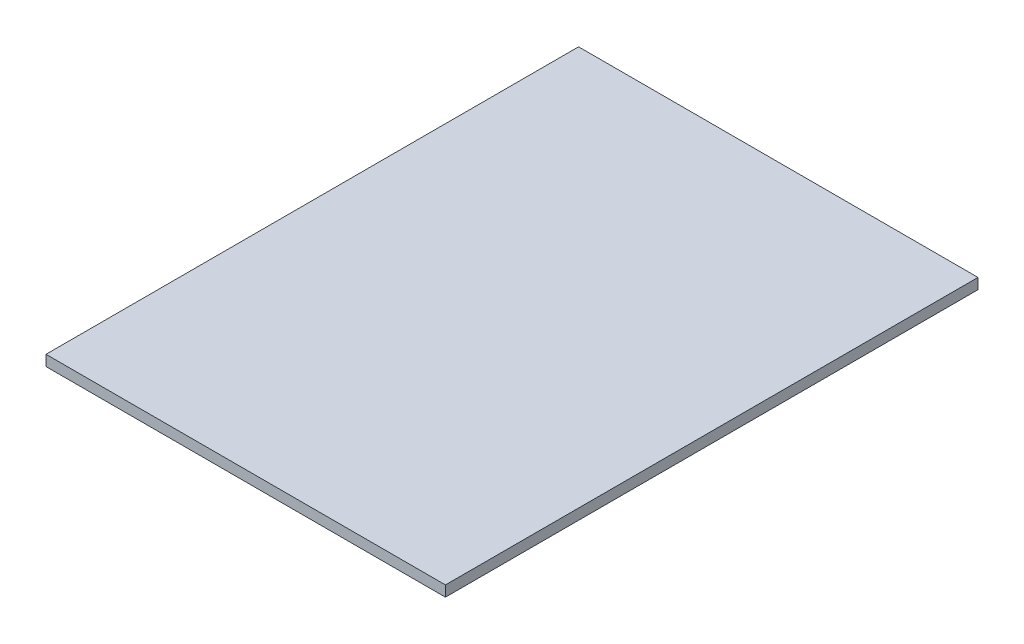
from build123d import *

# Parameters (mm, degrees)
SKETCH1_W           = 75
SKETCH1_H           = 100
BOSS_EXTRUDE1_DEPTH = 2


with BuildPart() as part:
    # Sketch1 → Boss-Extrude1 (new body)
    with BuildSketch(Plane(origin=(0, 0, 0), x_dir=(1, 0, 0), z_dir=(0, 1, 0))):
        Rectangle(SKETCH1_W, SKETCH1_H)
    extrude(amount=BOSS_EXTRUDE1_DEPTH)


solid = part.part
